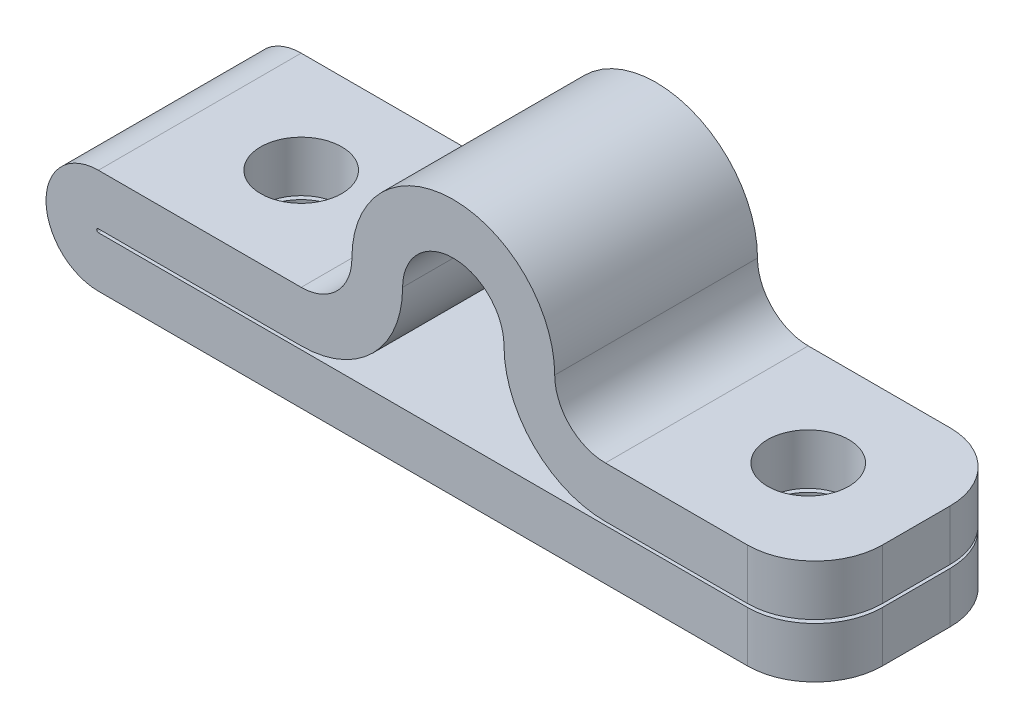
from build123d import *

# Parameters (mm, degrees)
BOSS_EXTRUDE1_DEPTH  = 3
M2_CLEARANCE_HOLE1_D = 2.4
FILLET1_R            = 2


with BuildPart() as part:
    # Sketch1 → Boss-Extrude1 (new, symmetric)
    with BuildSketch(Plane.XY):
        with BuildLine():
            ThreePointArc((-10.5, 3.1), (-12.05, 1.55), (-10.5, 0))
            Line((-10.5, 0), (10.7, 0))
            Line((10.7, 0), (10.7, 1.5))
            Line((10.7, 1.5), (-10.5, 1.5))
            ThreePointArc((-10.5, 1.5), (-10.55, 1.55), (-10.5, 1.6))
            Line((-10.5, 1.6), (-4.5, 1.6))
            ThreePointArc((-4.5, 1.6), (-2.378679656, 2.478679656), (-1.5, 4.6))
            ThreePointArc((-1.5, 4.6), (-1.060660172, 5.660660172), (0, 6.1))
            ThreePointArc((0, 6.1), (1.060660172, 5.660660172), (1.5, 4.6))
            ThreePointArc((1.5, 4.6), (2.378679656, 2.478679656), (4.5, 1.6))
            Line((4.5, 1.6), (10.7, 1.6))
            Line((10.7, 1.6), (10.7, 3.1))
            Line((10.7, 3.1), (4.5, 3.1))
            ThreePointArc((4.5, 3.1), (3.439339828, 3.539339828), (3, 4.6))
            ThreePointArc((3, 4.6), (2.121320344, 6.721320344), (0, 7.6))
            ThreePointArc((0, 7.6), (-2.121320344, 6.721320344), (-3, 4.6))
            ThreePointArc((-3, 4.6), (-3.439339828, 3.539339828), (-4.5, 3.1))
            Line((-4.5, 3.1), (-10.5, 3.1))
        make_face()
    extrude(amount=BOSS_EXTRUDE1_DEPTH, both=True)

    # M2 Clearance Hole1 (through all)
    with Locations(Plane(origin=(0, 3.1, 0), x_dir=(1, 0, 0), z_dir=(0, 1, 0))):
        with Locations((-7.5, 0), (7.5, 0)):
            Hole(M2_CLEARANCE_HOLE1_D / 2)

    # Fillet1
    fillet1_edges = [part.edges().sort_by_distance(p)[0] for p in [
        (10.7, 0.75, -3),
        (10.7, 2.35, -3),
        (10.7, 2.35, 3),
        (10.7, 0.75, 3),
    ]]
    fillet(fillet1_edges, radius=FILLET1_R)


solid = part.part
